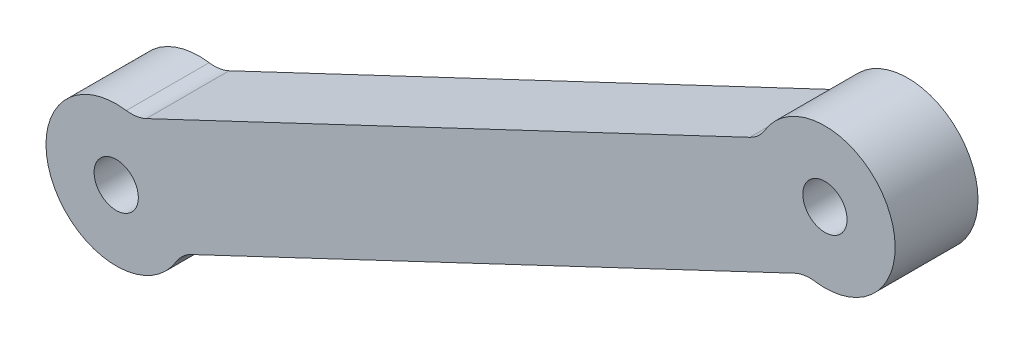
from build123d import *

# Parameters (mm, degrees)
SKETCH1_R           = 1.599999975
SKETCH1_R_2         = 1.6
BOSS_EXTRUDE1_DEPTH = 5.9944


with BuildPart() as part:
    # Sketch1 → Boss-Extrude1 (new body)
    with BuildSketch(Plane.XY):
        with BuildLine():
            Line((173.239119531, 87.828182542), (216.902225194, 108.487583799))
            ThreePointArc((216.902225194, 108.487583799), (217.611261892, 108.703439085), (218.352424901, 108.705423523))
            ThreePointArc((218.352424901, 108.705423523), (223.672060553, 115.905723877), (214.731271011, 116.358637812))
            ThreePointArc((214.731271011, 116.358637812), (214.259725595, 115.786823625), (213.643186694, 115.375476659))
            Line((213.643186694, 115.375476659), (169.980081031, 94.716075402))
            ThreePointArc((169.980081031, 94.716075402), (169.271044333, 94.500220116), (168.529881324, 94.498235678))
            ThreePointArc((168.529881324, 94.498235678), (163.210245672, 87.297935324), (172.151035214, 86.845021389))
            ThreePointArc((172.151035214, 86.845021389), (172.62258063, 87.416835576), (173.239119531, 87.828182542))
        make_face()
        with Locations((219.08013198, 113.733031543)):
            Circle(SKETCH1_R, mode=Mode.SUBTRACT)
        with Locations((167.802174245, 89.470627658)):
            Circle(SKETCH1_R_2, mode=Mode.SUBTRACT)
    extrude(amount=BOSS_EXTRUDE1_DEPTH)


solid = part.part
